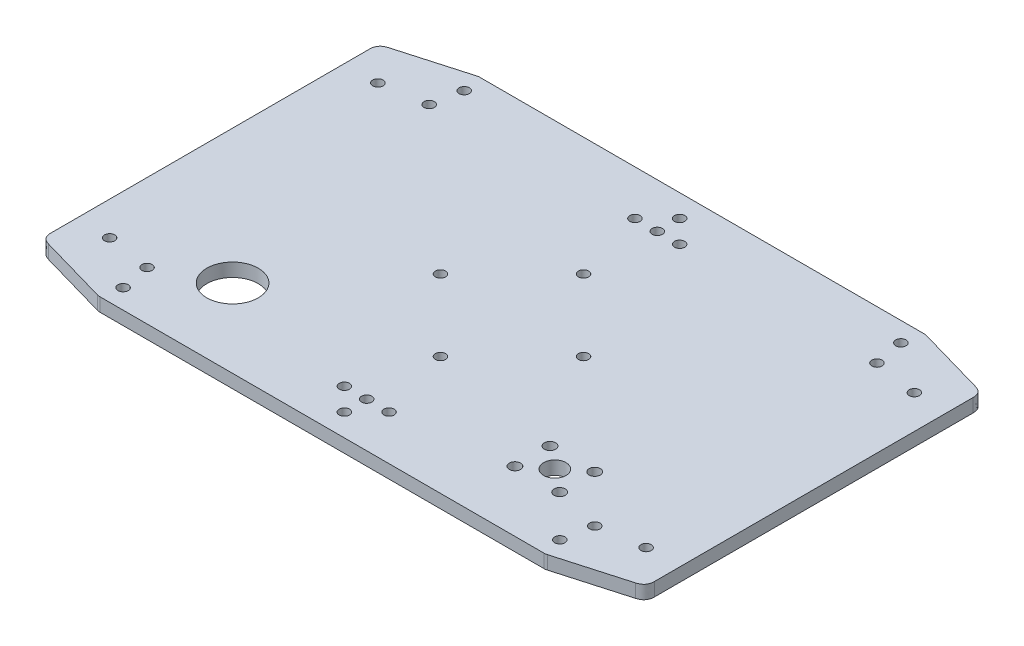
from build123d import *

# Parameters (mm, degrees)
BOSS_EXTRU_1_DEPTH        = 6
ENL_V_MAT_EXTRU_6_REACH   = 161.643
ESQUISSE15_R              = 2.3
ENL_V_MAT_EXTRU_7_REACH   = 161.643
ESQUISSE17_R              = 2.3
ENL_V_MAT_EXTRU_9_REACH   = 161.643
ESQUISSE19_R              = 11.5
ENL_V_MAT_EXTRU_10_REACH  = 161.643
ESQUISSE20_R              = 2.3
ESQUISSE21_R              = 2.5
ESQUISSE21_R_2            = 5
ENL_V_MAT_EXTRU_11_DEPTH  = 160.64335265
ENL_V_MAT_EXTRU_12_REACH  = 161.643
ESQUISSE22_R              = 2.3
SYM_TRIE7_COPY_1_REACH    = 161.643
SYM_TRIE7_COPY_1_SKETCH_R = 2.3


with BuildPart() as part:
    # Esquisse1 → Boss.-Extru.1 (new body)
    with BuildSketch(Plane(origin=(0, 0, 0), x_dir=(1, 0, 0), z_dir=(0, 1, 0))):
        Polygon((-135, 0), (-135, -75), (-100, -85), (0, -85), (100, -85), (135, -75), (135, 0), (135, 75), (100, 85), (0, 85), (-100, 85), (-135, 75), align=None)
    extrude(amount=BOSS_EXTRU_1_DEPTH)

    # Esquisse15 → Enlèv. mat.-Extru.6 (cut, up to next)
    with BuildSketch(Plane(origin=(0, 6, 0), x_dir=(1, 0, 0), z_dir=(0, 1, 0)), mode=Mode.PRIVATE) as enl_v_mat_extru_6_sk1:
        with Locations(Location((-120, -60, 0), (0, 0, 270))):
            Circle(ESQUISSE15_R)
    enl_v_mat_extru_6_tool1 = extrude(enl_v_mat_extru_6_sk1.sketch, amount=-ENL_V_MAT_EXTRU_6_REACH, mode=Mode.PRIVATE) & part.part
    # Esquisse15 → Enlèv. mat.-Extru.6 (cut, up to next)
    with BuildSketch(Plane(origin=(0, 6, 0), x_dir=(1, 0, 0), z_dir=(0, 1, 0)), mode=Mode.PRIVATE) as enl_v_mat_extru_6_sk2:
        with Locations(Location((-120, 60, 0), (0, 0, 270))):
            Circle(ESQUISSE15_R)
    enl_v_mat_extru_6_tool2 = extrude(enl_v_mat_extru_6_sk2.sketch, amount=-ENL_V_MAT_EXTRU_6_REACH, mode=Mode.PRIVATE) & part.part
    enl_v_mat_extru_6_1 = enl_v_mat_extru_6_tool1.solids().sort_by_distance((-120, 6, 60))[0]
    add(enl_v_mat_extru_6_1, mode=Mode.SUBTRACT)
    enl_v_mat_extru_6_2 = enl_v_mat_extru_6_tool2.solids().sort_by_distance((-120, 6, -60))[0]
    add(enl_v_mat_extru_6_2, mode=Mode.SUBTRACT)
    enl_v_mat_extru_6 = enl_v_mat_extru_6_1 + enl_v_mat_extru_6_2  # Enlèv. mat.-Extru.6 as one shape, for the pattern or mirror that repeats it

    # Symétrie5: Enlèv. mat.-Extru.6 across plane
    add(enl_v_mat_extru_6.mirror(Plane(origin=(0, 0, 0), x_dir=(0, 0, 1), z_dir=(1, 0, 0))), mode=Mode.SUBTRACT)

    # Esquisse17 → Enlèv. mat.-Extru.7 (cut, up to next)
    with BuildSketch(Plane(origin=(0, 6, 0), x_dir=(1, 0, 0), z_dir=(0, 1, 0)), mode=Mode.PRIVATE) as enl_v_mat_extru_7_sk1:
        with Locations(Location((0, -65, 0), (0, 0, 270))):
            Circle(ESQUISSE17_R)
    enl_v_mat_extru_7_tool1 = extrude(enl_v_mat_extru_7_sk1.sketch, amount=-ENL_V_MAT_EXTRU_7_REACH, mode=Mode.PRIVATE) & part.part
    # Esquisse17 → Enlèv. mat.-Extru.7 (cut, up to next)
    with BuildSketch(Plane(origin=(0, 6, 0), x_dir=(1, 0, 0), z_dir=(0, 1, 0)), mode=Mode.PRIVATE) as enl_v_mat_extru_7_sk2:
        with Locations(Location((10, -65, 0), (0, 0, 270))):
            Circle(ESQUISSE17_R)
    enl_v_mat_extru_7_tool2 = extrude(enl_v_mat_extru_7_sk2.sketch, amount=-ENL_V_MAT_EXTRU_7_REACH, mode=Mode.PRIVATE) & part.part
    # Esquisse17 → Enlèv. mat.-Extru.7 (cut, up to next)
    with BuildSketch(Plane(origin=(0, 6, 0), x_dir=(1, 0, 0), z_dir=(0, 1, 0)), mode=Mode.PRIVATE) as enl_v_mat_extru_7_sk3:
        with Locations(Location((-10, -65, 0), (0, 0, 270))):
            Circle(ESQUISSE17_R)
    enl_v_mat_extru_7_tool3 = extrude(enl_v_mat_extru_7_sk3.sketch, amount=-ENL_V_MAT_EXTRU_7_REACH, mode=Mode.PRIVATE) & part.part
    # Esquisse17 → Enlèv. mat.-Extru.7 (cut, up to next)
    with BuildSketch(Plane(origin=(0, 6, 0), x_dir=(1, 0, 0), z_dir=(0, 1, 0)), mode=Mode.PRIVATE) as enl_v_mat_extru_7_sk4:
        with Locations(Location((0, -75, 0), (0, 0, 270))):
            Circle(ESQUISSE17_R)
    enl_v_mat_extru_7_tool4 = extrude(enl_v_mat_extru_7_sk4.sketch, amount=-ENL_V_MAT_EXTRU_7_REACH, mode=Mode.PRIVATE) & part.part
    enl_v_mat_extru_7_1 = enl_v_mat_extru_7_tool1.solids().sort_by_distance((0, 6, 65))[0]
    add(enl_v_mat_extru_7_1, mode=Mode.SUBTRACT)
    enl_v_mat_extru_7_2 = enl_v_mat_extru_7_tool2.solids().sort_by_distance((10, 6, 65))[0]
    add(enl_v_mat_extru_7_2, mode=Mode.SUBTRACT)
    enl_v_mat_extru_7_3 = enl_v_mat_extru_7_tool3.solids().sort_by_distance((-10, 6, 65))[0]
    add(enl_v_mat_extru_7_3, mode=Mode.SUBTRACT)
    enl_v_mat_extru_7_4 = enl_v_mat_extru_7_tool4.solids().sort_by_distance((0, 6, 75))[0]
    add(enl_v_mat_extru_7_4, mode=Mode.SUBTRACT)
    enl_v_mat_extru_7 = enl_v_mat_extru_7_1 + enl_v_mat_extru_7_2 + enl_v_mat_extru_7_3 + enl_v_mat_extru_7_4  # Enlèv. mat.-Extru.7 as one shape, for the pattern or mirror that repeats it

    # Congé3
    # a fillet whose section is not a circle: 5 mm, written as the material it takes off along each edge
    with BuildSketch(Plane(origin=(-135, -9.428767659, -75), x_dir=(0, 0, 1), z_dir=(0, 1, 0))) as cong_3_piece_1:
        with BuildLine():
            Bezier((3.771507064, 0), (0, 0), (-1.036112674, 3.626394361), weights=[1, 1, 1])
            Line((-1.036112674, 3.626394361), (0, 0))
            Line((0, 0), (3.771507064, 0))
        make_face()
    extrude(amount=24.857535319, mode=Mode.SUBTRACT)
    with BuildSketch(Plane(origin=(-100, -1.750686808, -85), x_dir=(-0.9615239476408264, 0, 0.27472112789736736), z_dir=(0, 1, 0)), Plane(origin=(100, -1.750686808, -85), x_dir=(-1, 0, 0), z_dir=(0, 1, 0))) as cong_3_piece_2:
        with BuildLine():
            Bezier((0.700274723, 0), (0, 0), (-0.673330916, 0.192380262), weights=[1, 1, 1])
            Line((-0.673330916, 0.192380262), (0, 0))
            Line((0, 0), (0.700274723, 0))
        make_face()
    extrude(amount=9.501373616, mode=Mode.SUBTRACT)
    with BuildSketch(Plane(origin=(135, -9.428767659, -75), x_dir=(0, 0, 1), z_dir=(0, 1, 0)), Plane(origin=(135, -9.428767659, 75), x_dir=(-0.961523947640823, 0, 0.27472112789737857), z_dir=(0, 1, 0)), Plane(origin=(-135, -9.428767659, 75), x_dir=(0, 0, -1), z_dir=(0, 1, 0))) as cong_3_piece_3:
        with BuildLine():
            Bezier((3.771507064, 0), (0, 0), (-1.036112674, -3.626394361), weights=[1, 1, 1])
            Line((-1.036112674, -3.626394361), (0, 0))
            Line((0, 0), (3.771507064, 0))
        make_face()
    extrude(amount=24.857535319, mode=Mode.SUBTRACT)
    with BuildSketch(Plane(origin=(100, -1.750686808, 85), x_dir=(-1, 0, 0), z_dir=(0, 1, 0)), Plane(origin=(-100, -1.750686808, 85), x_dir=(-0.9615239476408264, 0, -0.27472112789736736), z_dir=(0, 1, 0))) as cong_3_piece_4:
        with BuildLine():
            Bezier((0.700274723, 0), (0, 0), (-0.673330916, -0.192380262), weights=[1, 1, 1])
            Line((-0.673330916, -0.192380262), (0, 0))
            Line((0, 0), (0.700274723, 0))
        make_face()
    extrude(amount=9.501373616, mode=Mode.SUBTRACT)

    # Esquisse19 → Enlèv. mat.-Extru.9 (cut, up to next)
    with BuildSketch(Plane(origin=(0, 6, 0), x_dir=(1, 0, 0), z_dir=(0, 1, 0)), mode=Mode.PRIVATE) as enl_v_mat_extru_9_sk1:
        with Locations(Location((-75, -50, 0), (0, 0, 270))):
            Circle(ESQUISSE19_R)
    enl_v_mat_extru_9_tool1 = extrude(enl_v_mat_extru_9_sk1.sketch, amount=-ENL_V_MAT_EXTRU_9_REACH, mode=Mode.PRIVATE) & part.part
    add(enl_v_mat_extru_9_tool1.solids().sort_by_distance((-75, 6, 50))[0], mode=Mode.SUBTRACT)

    # Esquisse20 → Enlèv. mat.-Extru.10 (cut, up to next)
    with BuildSketch(Plane(origin=(0, 6, 0), x_dir=(1, 0, 0), z_dir=(0, 1, 0)), mode=Mode.PRIVATE) as enl_v_mat_extru_10_sk1:
        with Locations(Location((-32, 0, 0), (0, 0, 270))):
            Circle(ESQUISSE20_R)
    enl_v_mat_extru_10_tool1 = extrude(enl_v_mat_extru_10_sk1.sketch, amount=-ENL_V_MAT_EXTRU_10_REACH, mode=Mode.PRIVATE) & part.part
    # Esquisse20 → Enlèv. mat.-Extru.10 (cut, up to next)
    with BuildSketch(Plane(origin=(0, 6, 0), x_dir=(1, 0, 0), z_dir=(0, 1, 0)), mode=Mode.PRIVATE) as enl_v_mat_extru_10_sk2:
        with Locations(Location((0, -32, 0), (0, 0, 270))):
            Circle(ESQUISSE20_R)
    enl_v_mat_extru_10_tool2 = extrude(enl_v_mat_extru_10_sk2.sketch, amount=-ENL_V_MAT_EXTRU_10_REACH, mode=Mode.PRIVATE) & part.part
    # Esquisse20 → Enlèv. mat.-Extru.10 (cut, up to next)
    with BuildSketch(Plane(origin=(0, 6, 0), x_dir=(1, 0, 0), z_dir=(0, 1, 0)), mode=Mode.PRIVATE) as enl_v_mat_extru_10_sk3:
        with Locations(Location((32, 0, 0), (0, 0, 270))):
            Circle(ESQUISSE20_R)
    enl_v_mat_extru_10_tool3 = extrude(enl_v_mat_extru_10_sk3.sketch, amount=-ENL_V_MAT_EXTRU_10_REACH, mode=Mode.PRIVATE) & part.part
    # Esquisse20 → Enlèv. mat.-Extru.10 (cut, up to next)
    with BuildSketch(Plane(origin=(0, 6, 0), x_dir=(1, 0, 0), z_dir=(0, 1, 0)), mode=Mode.PRIVATE) as enl_v_mat_extru_10_sk4:
        with Locations(Location((0, 32, 0), (0, 0, 270))):
            Circle(ESQUISSE20_R)
    enl_v_mat_extru_10_tool4 = extrude(enl_v_mat_extru_10_sk4.sketch, amount=-ENL_V_MAT_EXTRU_10_REACH, mode=Mode.PRIVATE) & part.part
    add(enl_v_mat_extru_10_tool1.solids().sort_by_distance((-32, 6, 0))[0], mode=Mode.SUBTRACT)
    add(enl_v_mat_extru_10_tool2.solids().sort_by_distance((0, 6, 32))[0], mode=Mode.SUBTRACT)
    add(enl_v_mat_extru_10_tool3.solids().sort_by_distance((32, 6, 0))[0], mode=Mode.SUBTRACT)
    add(enl_v_mat_extru_10_tool4.solids().sort_by_distance((0, 6, -32))[0], mode=Mode.SUBTRACT)

    # Esquisse21 → Enlèv. mat.-Extru.11 (cut, through all)
    with BuildSketch(Plane(origin=(0, 6, 0), x_dir=(1, 0, 0), z_dir=(0, 1, 0))):
        with Locations(Location((59.159670332, -42.15, 0), (0, 0, 270))):
            Circle(ESQUISSE21_R)
        with Locations(Location((59.159670332, -57.85, 0), (0, 0, 270))):
            Circle(ESQUISSE21_R)
        with Locations(Location((79.159670332, -42.15, 0), (0, 0, 270))):
            Circle(ESQUISSE21_R)
        with Locations(Location((79.159670332, -57.85, 0), (0, 0, 270))):
            Circle(ESQUISSE21_R)
        with Locations(Location((69.159670332, -50, 0), (0, 0, 270))):
            Circle(ESQUISSE21_R_2)
    extrude(amount=-ENL_V_MAT_EXTRU_11_DEPTH, mode=Mode.SUBTRACT)

    # Esquisse22 → Enlèv. mat.-Extru.12 (cut, up to next)
    with BuildSketch(Plane(origin=(0, 6, 0), x_dir=(1, 0, 0), z_dir=(0, 1, 0)), mode=Mode.PRIVATE) as enl_v_mat_extru_12_sk1:
        with Locations(Location((-100.158323142, -63.114435149, 0), (0, 0, 270))):
            Circle(ESQUISSE22_R)
    enl_v_mat_extru_12_tool1 = extrude(enl_v_mat_extru_12_sk1.sketch, amount=-ENL_V_MAT_EXTRU_12_REACH, mode=Mode.PRIVATE) & part.part
    # Esquisse22 → Enlèv. mat.-Extru.12 (cut, up to next)
    with BuildSketch(Plane(origin=(0, 6, 0), x_dir=(1, 0, 0), z_dir=(0, 1, 0)), mode=Mode.PRIVATE) as enl_v_mat_extru_12_sk2:
        with Locations(Location((-97.685832991, -76.301049288, 0), (0, 0, 270))):
            Circle(ESQUISSE22_R)
    enl_v_mat_extru_12_tool2 = extrude(enl_v_mat_extru_12_sk2.sketch, amount=-ENL_V_MAT_EXTRU_12_REACH, mode=Mode.PRIVATE) & part.part
    enl_v_mat_extru_12_1 = enl_v_mat_extru_12_tool1.solids().sort_by_distance((-100.158323, 6, 63.114435))[0]
    add(enl_v_mat_extru_12_1, mode=Mode.SUBTRACT)
    enl_v_mat_extru_12_2 = enl_v_mat_extru_12_tool2.solids().sort_by_distance((-97.685833, 6, 76.301049))[0]
    add(enl_v_mat_extru_12_2, mode=Mode.SUBTRACT)
    enl_v_mat_extru_12 = enl_v_mat_extru_12_1 + enl_v_mat_extru_12_2  # Enlèv. mat.-Extru.12 as one shape, for the pattern or mirror that repeats it

    # Symétrie6: Enlèv. mat.-Extru.12 across plane
    add(enl_v_mat_extru_12.mirror(Plane(origin=(0, 0, 0), x_dir=(0, 0, 1), z_dir=(1, 0, 0))), mode=Mode.SUBTRACT)

    # Symétrie7: Enlèv. mat.-Extru.12 across plane
    add(enl_v_mat_extru_12.mirror(Plane.XY), mode=Mode.SUBTRACT)

    # Symétrie7 copy 1 sketch → Symétrie7 copy 1 (cut, up to next)
    with BuildSketch(Plane(origin=(0, 6, 0), x_dir=(-1, 0, 0), z_dir=(0, 1, 0)), mode=Mode.PRIVATE) as sym_trie7_copy_1_sk1:
        with Locations(Location((-100.158323142, -63.114435149, 0), (0, 0, 270))):
            Circle(SYM_TRIE7_COPY_1_SKETCH_R)
    sym_trie7_copy_1_tool1 = extrude(sym_trie7_copy_1_sk1.sketch, amount=-SYM_TRIE7_COPY_1_REACH, mode=Mode.PRIVATE) & part.part
    # Symétrie7 copy 1 sketch → Symétrie7 copy 1 (cut, up to next)
    with BuildSketch(Plane(origin=(0, 6, 0), x_dir=(-1, 0, 0), z_dir=(0, 1, 0)), mode=Mode.PRIVATE) as sym_trie7_copy_1_sk2:
        with Locations(Location((-97.685832991, -76.301049288, 0), (0, 0, 270))):
            Circle(SYM_TRIE7_COPY_1_SKETCH_R)
    sym_trie7_copy_1_tool2 = extrude(sym_trie7_copy_1_sk2.sketch, amount=-SYM_TRIE7_COPY_1_REACH, mode=Mode.PRIVATE) & part.part
    add(sym_trie7_copy_1_tool1.solids().sort_by_distance((100.158323, 6, -63.114435))[0], mode=Mode.SUBTRACT)
    add(sym_trie7_copy_1_tool2.solids().sort_by_distance((97.685833, 6, -76.301049))[0], mode=Mode.SUBTRACT)

    # Symétrie8: Enlèv. mat.-Extru.7 across plane
    add(enl_v_mat_extru_7.mirror(Plane.XY), mode=Mode.SUBTRACT)


solid = part.part
